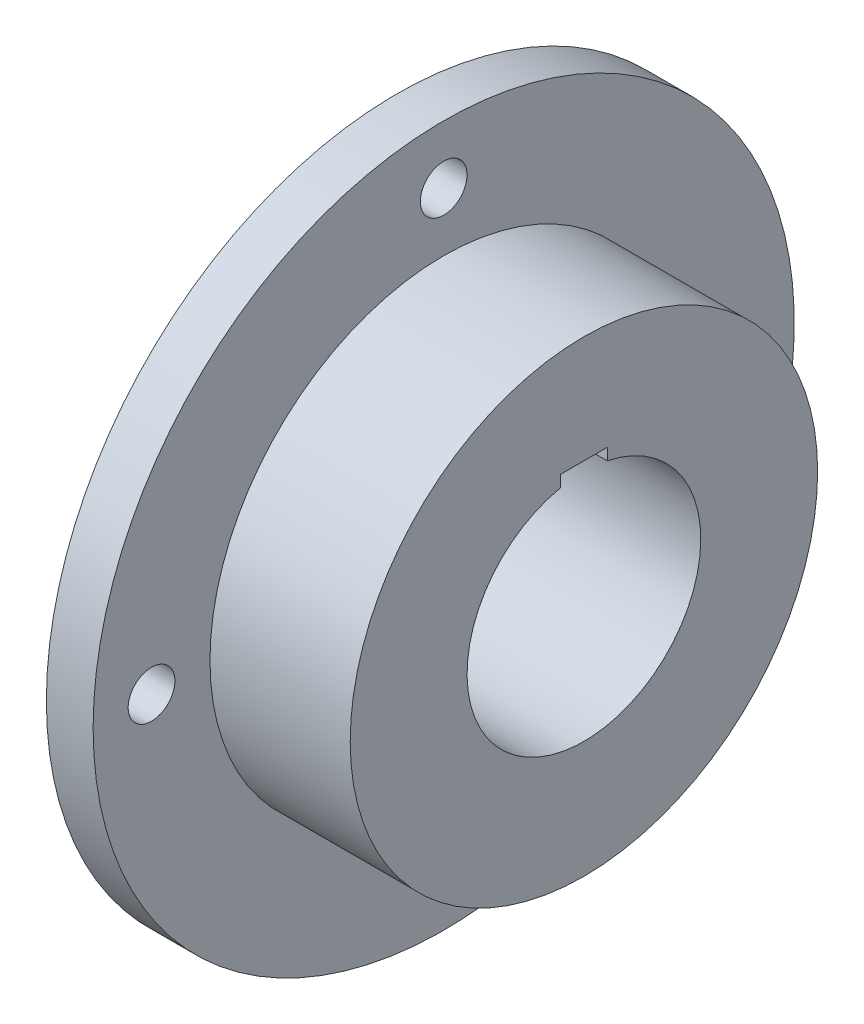
from build123d import *
from build123d.topology import SkipClean

# Parameters (mm, degrees)
SKETCH1_R           = 20
SKETCH1_R_2         = 10
BOSS_EXTRUDE1_DEPTH = 7
SKETCH2_R           = 30
SKETCH2_R_2         = 10
BOSS_EXTRUDE2_DEPTH = 2
SKETCH3_R           = 2
CUT_EXTRUDE1_DEPTH  = 45.09081537
CUT_EXTRUDE2_DEPTH  = 46.343136195


with BuildPart() as part:
    # Sketch1 → Boss-Extrude1 (new, symmetric)
    with BuildSketch(Plane(origin=(0, 0, 0), x_dir=(0, 0, -1), z_dir=(1, 0, 0))):
        Circle(SKETCH1_R)
        Circle(SKETCH1_R_2, mode=Mode.SUBTRACT)
    extrude(amount=BOSS_EXTRUDE1_DEPTH, both=True)

    # Sketch2 → Boss-Extrude2 (add, symmetric)
    with BuildSketch(Plane.ZY.offset(7)):
        Circle(SKETCH2_R)
        Circle(SKETCH2_R_2, mode=Mode.SUBTRACT)
    extrude(amount=BOSS_EXTRUDE2_DEPTH, both=True)

    # Sketch3 → Cut-Extrude1 (cut, through all)
    with BuildSketch(Plane(origin=(-5, 0, 0), x_dir=(0, 0, -1), z_dir=(1, 0, 0))):
        with Locations((0, 25)):
            Circle(SKETCH3_R)
        with Locations((25, 0)):
            Circle(SKETCH3_R)
        with Locations((0, -25)):
            Circle(SKETCH3_R)
        with Locations((-25, 0)):
            Circle(SKETCH3_R)
    extrude(amount=-CUT_EXTRUDE1_DEPTH, mode=Mode.SUBTRACT)

    # Sketch4 → Cut-Extrude2 (cut, through all)
    with SkipClean():  # the faces are left unmerged after this step: merging them gives an invalid solid
        with BuildSketch(Plane(origin=(7, 0, 0), x_dir=(0, 0, -1), z_dir=(1, 0, 0))):
            with BuildLine():
                ThreePointArc((-2, 9.797958971), (0, 10), (2, 9.797958971))
                Line((2, 9.797958971), (2, 10.797958971))
                Line((2, 10.797958971), (-2, 10.797958971))
                Line((-2, 10.797958971), (-2, 9.797958971))
            make_face()
        extrude(amount=-CUT_EXTRUDE2_DEPTH, mode=Mode.SUBTRACT)


solid = part.part
